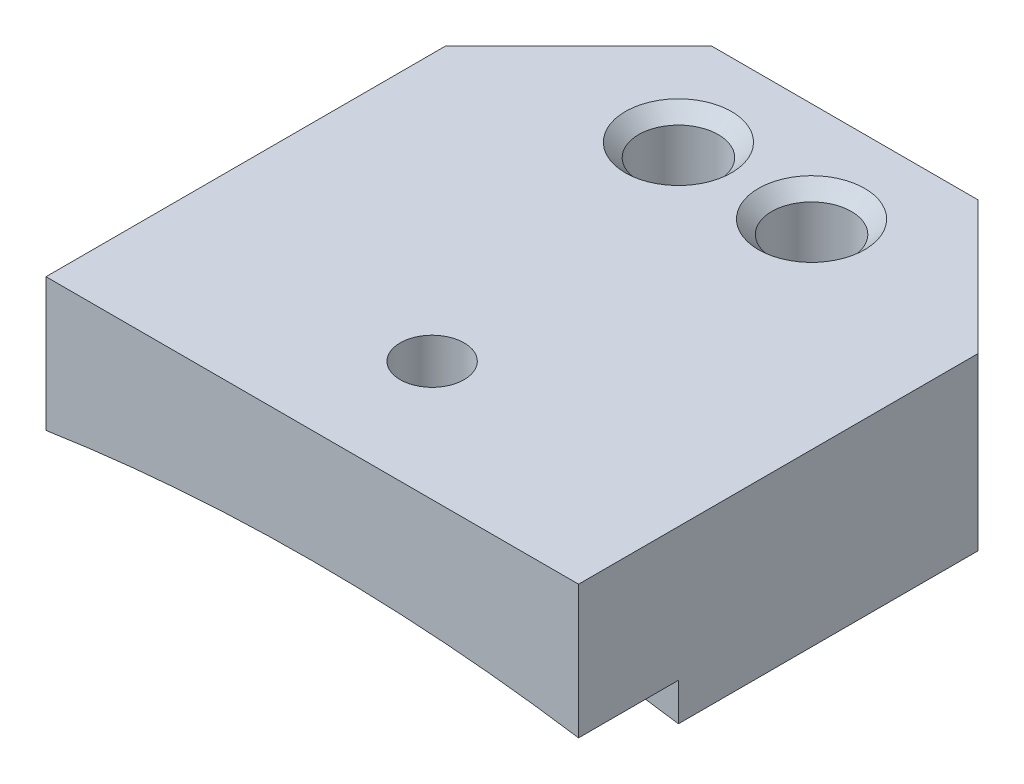
from build123d import *

# Parameters (mm, degrees)
BOSS_EXTRUDE1_DEPTH              = 6.35
CUT_EXTRUDE1_DEPTH               = 39.709258643
CUT_EXTRUDE1_DEPTH_BACK          = 39.709258643
SKETCH2_R                        = 83.82
BOSS_EXTRUDE2_DEPTH              = 20.6375
CHAMFER1_SIZE                    = 6.35
F_10_24_TAPPED_HOLE1_D           = 3.7973
F_10_24_TAPPED_HOLE1_CSINK_D     = 5.0673
F_10_24_TAPPED_HOLE1_CSINK_ANGLE = 90
SKETCH6_R                        = 1.524
CUT_EXTRUDE2_DEPTH               = 33.316173568


with BuildPart() as part:
    # Sketch1 → Boss-Extrude1 (new body)
    with BuildSketch(Plane(origin=(0, 0, 0), x_dir=(1, 0, 0), z_dir=(0, 1, 0))):
        Polygon((-28.511825699, 6.495271113), (-22.161825699, 12.845271113), (-9.461825699, 12.845271113), (-3.111825699, 6.495271113), (-3.111825699, -12.554728887), (-28.511825699, -12.554728887), align=None)
    extrude(amount=BOSS_EXTRUDE1_DEPTH)

    # Sketch2 → Cut-Extrude1 (cut, two sides: drawn at the far end of the back side and taken through both)
    with BuildSketch(Plane.XY.offset(12.554728887).offset(-CUT_EXTRUDE1_DEPTH_BACK)):
        with Locations((-15.811825699, -82.852292666)):
            Circle(SKETCH2_R)
    extrude(amount=CUT_EXTRUDE1_DEPTH + CUT_EXTRUDE1_DEPTH_BACK, mode=Mode.SUBTRACT)

    # Sketch5 → Boss-Extrude2 (add)
    with BuildSketch(Plane(origin=(0, 0, -12.845271113), x_dir=(-1, 0, 0), z_dir=(0, 0, -1))):
        with BuildLine():
            Line((3.111825699, 6.35), (3.111825699, 0))
            Line((3.111825699, 0), (3.111825699, -1.799225087))
            ThreePointArc((3.111825699, -1.799225087), (15.811825699, -0.810292666), (28.511825699, -1.799225087))
            Line((28.511825699, -1.799225087), (28.511825699, 0))
            Line((28.511825699, 0), (28.511825699, 6.35))
            Line((28.511825699, 6.35), (3.111825699, 6.35))
        make_face()
    extrude(amount=-BOSS_EXTRUDE2_DEPTH)

    # Chamfer1
    chamfer1_edges = [part.edges().sort_by_distance(p)[0] for p in [
        (-28.511825699, 2.275387457, -12.845271113),
        (-3.111825699, 2.275387457, -12.845271113),
    ]]
    chamfer(chamfer1_edges, length=CHAMFER1_SIZE)

    # #10-24 Tapped Hole1 (through all)
    with Locations(Plane(origin=(0, 6.35, 0), x_dir=(1, 0, 0), z_dir=(0, 1, 0))):
        with Locations((-18.986825699, 8.082771113), (-12.636825699, 8.082771113)):
            CounterSinkHole(F_10_24_TAPPED_HOLE1_D / 2, F_10_24_TAPPED_HOLE1_CSINK_D / 2, counter_sink_angle=F_10_24_TAPPED_HOLE1_CSINK_ANGLE)

    # Sketch6 → Cut-Extrude2 (cut, through all)
    with BuildSketch(Plane(origin=(0, 6.35, 0), x_dir=(1, 0, 0), z_dir=(0, 1, 0))):
        with Locations((-15.810195404, -6.839728887)):
            Circle(SKETCH6_R)
    extrude(amount=-CUT_EXTRUDE2_DEPTH, mode=Mode.SUBTRACT)


solid = part.part
